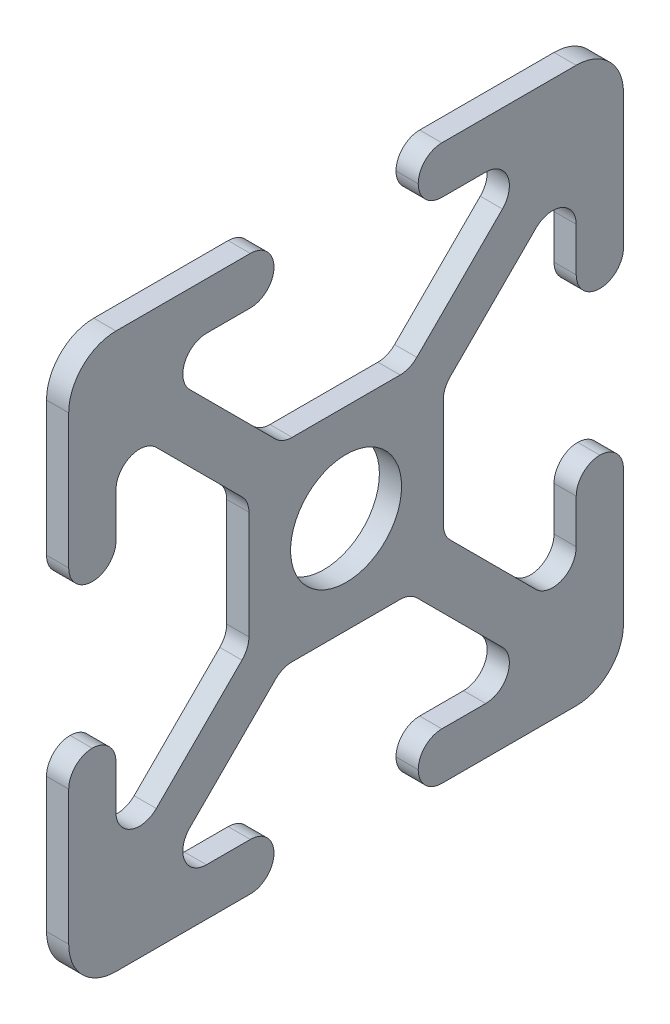
from build123d import *

# Parameters (mm, degrees)
SKETCH1_R           = 2.5
BOSS_EXTRUDE1_DEPTH = 1
FILLET1_R           = 1.065
FILLET2_R           = 2.13


with BuildPart() as part:
    # Sketch1 → Boss-Extrude1 (new body)
    with BuildSketch(Plane.YZ):
        Polygon((-12.5, -3.25), (-12.5, -12.5), (-3.25, -12.5), (-3.25, -10.37), (-8.863862556, -10.37), (-2.873862556, -4.38), (2.873862556, -4.38), (8.863862556, -10.37), (3.25, -10.37), (3.25, -12.5), (12.5, -12.5), (12.5, -3.25), (10.37, -3.25), (10.37, -8.863862556), (4.38, -2.873862556), (4.38, 2.873862556), (10.37, 8.863862556), (10.37, 3.25), (12.5, 3.25), (12.5, 12.5), (3.25, 12.5), (3.25, 10.37), (8.863862556, 10.37), (2.873862556, 4.38), (-2.873862556, 4.38), (-8.863862556, 10.37), (-3.25, 10.37), (-3.25, 12.5), (-12.5, 12.5), (-12.5, 3.25), (-10.37, 3.25), (-10.37, 8.863862556), (-4.38, 2.873862556), (-4.38, -2.873862556), (-10.37, -8.863862556), (-10.37, -3.25), align=None)
        with Locations(Location((0, 0, 0), (0, 0, 270))):
            Circle(SKETCH1_R, mode=Mode.SUBTRACT)
    extrude(amount=BOSS_EXTRUDE1_DEPTH)

    # Fillet1
    fillet1_edges = [part.edges().sort_by_distance(p)[0] for p in [
        (0.5, -10.37, -8.863862556),
        (0.5, 2.873862556, -4.38),
        (0.5, -2.873862556, -4.38),
        (0.5, -4.38, 2.873862556),
        (0.5, -4.38, -2.873862556),
        (0.5, -2.873862556, 4.38),
        (0.5, 2.873862556, 4.38),
        (0.5, 4.38, 2.873862556),
        (0.5, 4.38, -2.873862556),
        (0.5, -8.863862556, -10.37),
        (0.5, 8.863862556, -10.37),
        (0.5, 10.37, -8.863862556),
        (0.5, -10.37, 8.863862556),
        (0.5, -8.863862556, 10.37),
        (0.5, 10.37, 8.863862556),
        (0.5, 8.863862556, 10.37),
        (0.5, 12.5, 3.25),
        (0.5, -3.25, -12.5),
        (0.5, -10.37, 3.25),
        (0.5, 10.37, 3.25),
        (0.5, -10.37, -3.25),
        (0.5, -12.5, -3.25),
        (0.5, -12.5, 3.25),
        (0.5, 3.25, -10.37),
        (0.5, -3.25, -10.37),
        (0.5, 3.25, -12.5),
        (0.5, 10.37, -3.25),
        (0.5, 12.5, -3.25),
        (0.5, 3.25, 12.5),
        (0.5, 3.25, 10.37),
        (0.5, -3.25, 10.37),
        (0.5, -3.25, 12.5),
    ]]
    fillet(fillet1_edges, radius=FILLET1_R - 0.0001)  # a hair under: the kernel refuses the full size

    # Fillet2
    fillet2_edges = [part.edges().sort_by_distance(p)[0] for p in [
        (0.5, -12.5, 12.5),
        (0.5, 12.5, 12.5),
        (0.5, 12.5, -12.5),
        (0.5, -12.5, -12.5),
    ]]
    fillet(fillet2_edges, radius=FILLET2_R)


solid = part.part
